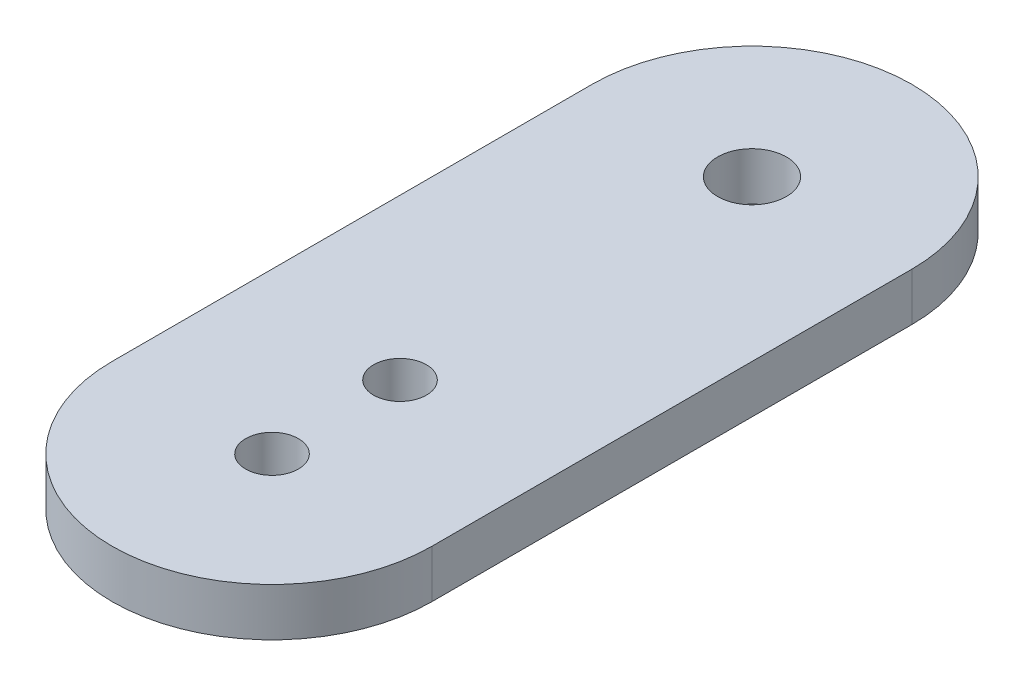
from build123d import *

# Parameters (mm, degrees)
BOSS_EXTRUDE1_DEPTH = 3
SKETCH3_R           = 1.65
SKETCH3_R_2         = 2.15
CUT_EXTRUDE1_DEPTH  = 3


with BuildPart() as part:
    # Sketch2 → Boss-Extrude1 (new body)
    with BuildSketch(Plane(origin=(0, 0, 0), x_dir=(1, 0, 0), z_dir=(0, 1, 0))):
        with BuildLine():
            Line((-10, 0), (-10, 30))
            ThreePointArc((-10, 30), (0, 40), (10, 30))
            Line((10, 30), (10, 0))
            ThreePointArc((10, 0), (0, -10), (-10, 0))
        make_face()
    extrude(amount=BOSS_EXTRUDE1_DEPTH)

    # Sketch3 → Cut-Extrude1 (cut)
    with BuildSketch(Plane(origin=(0, 3, 0), x_dir=(1, 0, 0), z_dir=(0, 1, 0))):
        Circle(SKETCH3_R)
        with Locations((0, 8)):
            Circle(SKETCH3_R)
        with Locations((0, 30)):
            Circle(SKETCH3_R_2)
    extrude(amount=-CUT_EXTRUDE1_DEPTH, mode=Mode.SUBTRACT)


solid = part.part
